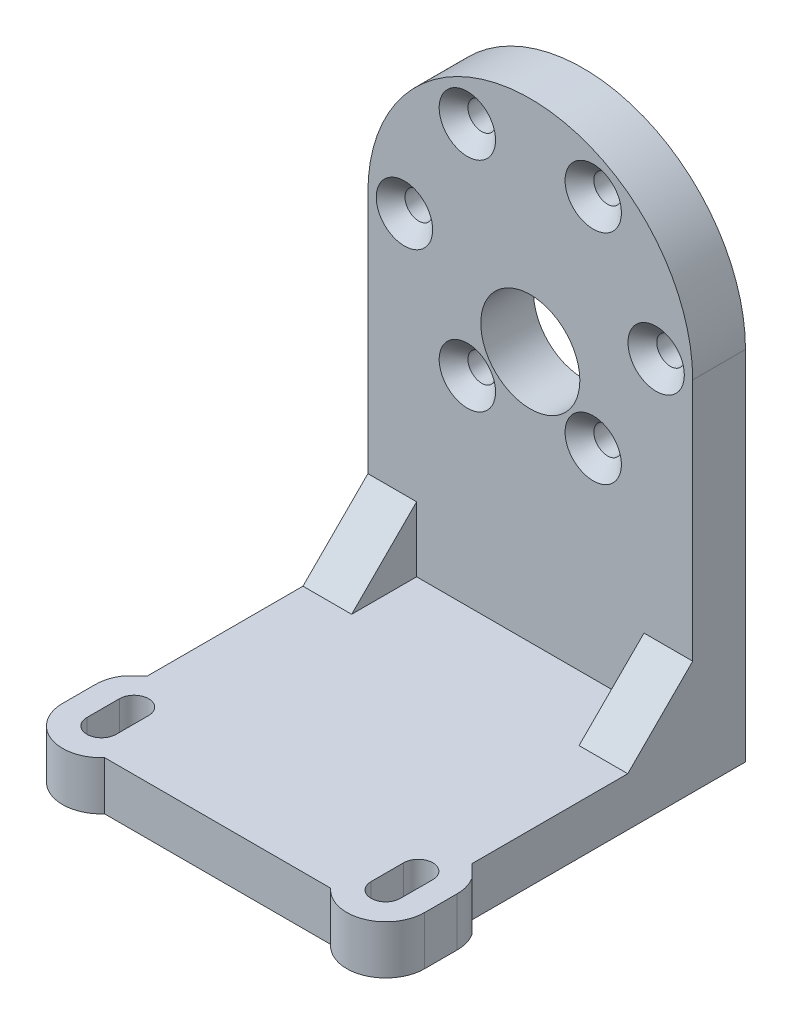
from build123d import *

# Parameters (mm, degrees)
SKETCH1_R                                            = 20
BOSS_EXTRUDE1_DEPTH                                  = 6.5
CSK_FOR_M3_HEX_SOCKET_COUNTERSUNK_HEAD_S_D           = 3.4
CSK_FOR_M3_HEX_SOCKET_COUNTERSUNK_HEAD_S_CSINK_D     = 6.94
CSK_FOR_M3_HEX_SOCKET_COUNTERSUNK_HEAD_S_CSINK_ANGLE = 90
F_12_2_12_2_DIAMETER_HOLE1_D                         = 12.2
BOSS_EXTRUDE2_START                                  = -6.5
BOSS_EXTRUDE2_DEPTH                                  = 6.5
SKETCH7_W                                            = 40
SKETCH7_H                                            = 45
BOSS_EXTRUDE3_DEPTH                                  = 6
M3_CLEARANCE_HOLE2_D                                 = 3.6
CUT_EXTRUDE1_DEPTH                                   = 77.085478247
CUT_EXTRUDE1_DEPTH_BACK                              = 77.085478247
BOSS_EXTRUDE4_DEPTH                                  = 6
CHAMFER1_START                                       = -45
CHAMFER1_DEPTH                                       = 8
CHAMFER1_START_2                                     = -44
CHAMFER1_2_DEPTH                                     = 6
BOSS_EXTRUDE5_DEPTH                                  = 6
BOSS_EXTRUDE6_START                                  = -40
BOSS_EXTRUDE6_DEPTH                                  = 6


with BuildPart() as part:
    # Sketch1 → Boss-Extrude1 (new body)
    with BuildSketch(Plane.XY):
        with Locations(Location((0, 0, 0), (0, 0, 180))):
            Circle(SKETCH1_R)
    extrude(amount=BOSS_EXTRUDE1_DEPTH)

    # CSK for M3 Hex Socket Countersunk Head Screw1 (through all)
    with Locations(Plane.XY.offset(6.5)):
        with Locations((-7.75, -13.423393759), (-15.5, 0), (-7.75, 13.423393759), (7.75, 13.423393759), (15.5, 0), (7.75, -13.423393759)):
            CounterSinkHole(CSK_FOR_M3_HEX_SOCKET_COUNTERSUNK_HEAD_S_D / 2, CSK_FOR_M3_HEX_SOCKET_COUNTERSUNK_HEAD_S_CSINK_D / 2, counter_sink_angle=CSK_FOR_M3_HEX_SOCKET_COUNTERSUNK_HEAD_S_CSINK_ANGLE)

    # Ø12.2 (12.2) Diameter Hole1 (through all)
    with Locations(Plane.XY.offset(6.5)):
        with Locations((0, -7)):
            Hole(F_12_2_12_2_DIAMETER_HOLE1_D / 2)

    # Sketch6 → Boss-Extrude2 (add)
    with BuildSketch(Plane.XY.offset(6.5).offset(BOSS_EXTRUDE2_START)):
        with BuildLine():
            Line((-20, 0), (-20, -38))
            Line((-20, -38), (20, -38))
            Line((20, -38), (20, 0))
            ThreePointArc((20, 0), (0, -20), (-20, 0))
        make_face()
    extrude(amount=BOSS_EXTRUDE2_DEPTH)

    # Sketch7 → Boss-Extrude3 (add)
    with BuildSketch(Plane.XZ.offset(38)):
        with Locations((0, 22.5)):
            Rectangle(SKETCH7_W, SKETCH7_H)
    extrude(amount=BOSS_EXTRUDE3_DEPTH)

    # M3 Clearance Hole2 (through all)
    with Locations(Plane(origin=(0, -44, 0), x_dir=(-1, 0, 0), z_dir=(0, -1, 0))):
        with Locations((-17.5, -39.802814471), (17.5, -39.802814471)):
            Hole(M3_CLEARANCE_HOLE2_D / 2)

    # Sketch11 → Cut-Extrude1 (cut, two sides: drawn at the far end of the back side and taken through both)
    with BuildSketch(Plane(origin=(0, -38, 0), x_dir=(1, 0, 0), z_dir=(0, 1, 0)).offset(-CUT_EXTRUDE1_DEPTH_BACK)):
        with BuildLine():
            Line((-15.7, -37.802814471), (-15.7, -41.802814471))
            ThreePointArc((-15.7, -41.802814471), (-17.5, -43.602814471), (-19.3, -41.802814471))
            Line((-19.3, -41.802814471), (-19.3, -37.802814471))
            ThreePointArc((-19.3, -37.802814471), (-17.5, -36.002814471), (-15.7, -37.802814471))
        make_face()
        with BuildLine():
            Line((15.7, -37.802814471), (15.7, -41.802814471))
            ThreePointArc((15.7, -41.802814471), (17.5, -43.602814471), (19.3, -41.802814471))
            Line((19.3, -41.802814471), (19.3, -37.802814471))
            ThreePointArc((19.3, -37.802814471), (17.5, -36.002814471), (15.7, -37.802814471))
        make_face()
    extrude(amount=CUT_EXTRUDE1_DEPTH + CUT_EXTRUDE1_DEPTH_BACK, mode=Mode.SUBTRACT)

    # Sketch10 → Boss-Extrude4 (add)
    # profile 1 of 2: a face of its own
    with BuildSketch(Plane.XZ.offset(44)):
        with BuildLine():
            Line((-22.3, 37.802814471), (-22.3, 41.802814471))
            ThreePointArc((-22.3, 41.802814471), (-17.5, 46.602814471), (-12.7, 41.802814471))
            Line((-12.7, 41.802814471), (-12.7, 37.802814471))
            ThreePointArc((-12.7, 37.802814471), (-17.5, 33.002814471), (-22.3, 37.802814471))
        make_face()
        with BuildLine():
            Line((-19.3, 37.802814471), (-19.3, 41.802814471))
            ThreePointArc((-19.3, 41.802814471), (-17.5, 43.602814471), (-15.7, 41.802814471))
            Line((-15.7, 41.802814471), (-15.7, 37.802814471))
            ThreePointArc((-15.7, 37.802814471), (-17.5, 36.002814471), (-19.3, 37.802814471))
        make_face(mode=Mode.SUBTRACT)
    # profile 2 of 2: a face of its own
    with BuildSketch(Plane.XZ.offset(44)):
        with BuildLine():
            Line((22.3, 41.802814471), (22.3, 37.802814471))
            ThreePointArc((22.3, 37.802814471), (17.5, 33.002814471), (12.7, 37.802814471))
            Line((12.7, 37.802814471), (12.7, 41.802814471))
            ThreePointArc((12.7, 41.802814471), (17.5, 46.602814471), (22.3, 41.802814471))
        make_face()
        with BuildLine():
            Line((19.3, 41.802814471), (19.3, 37.802814471))
            ThreePointArc((19.3, 37.802814471), (17.5, 36.002814471), (15.7, 37.802814471))
            Line((15.7, 37.802814471), (15.7, 41.802814471))
            ThreePointArc((15.7, 41.802814471), (17.5, 43.602814471), (19.3, 41.802814471))
        make_face(mode=Mode.SUBTRACT)
    extrude(amount=-BOSS_EXTRUDE4_DEPTH)

    # Chamfer1: read off the stored shape, not the designer's step
    # Chamfer1 outline → Chamfer1 (cut)
    with BuildSketch(Plane(origin=(0, 0, 0), x_dir=(1, 0, 0), z_dir=(0, 1, 0)).offset(CHAMFER1_START)):
        with BuildLine():
            Line((20.05286265, -33.7379784), (21.57746495, -35.270171666))
            ThreePointArc((21.57746495, -35.270171666), (20.902530686, -34.417140989), (20.05286265, -33.7379784))
        make_face()
        with BuildLine():
            ThreePointArc((-20.05286265, -33.7379784), (-20.902530686, -34.417140989), (-21.57746495, -35.270171666))
            Line((-21.57746495, -35.270171666), (-20.05286265, -33.7379784))
        make_face()
    extrude(amount=CHAMFER1_DEPTH, mode=Mode.SUBTRACT)

    # Chamfer1 2 outline → Chamfer1 2 (add)
    with BuildSketch(Plane(origin=(0, 0, 0), x_dir=(1, 0, 0), z_dir=(0, 1, 0)).offset(CHAMFER1_START_2)):
        with BuildLine():
            ThreePointArc((20, -33.705254222), (20.026484308, -33.721530722), (20.05286265, -33.7379784))
            Line((20.05286265, -33.7379784), (20, -33.684852548))
            Line((20, -33.684852548), (20, -33.705254222))
        make_face()
        with BuildLine():
            Line((-20, -33.684852548), (-20.05286265, -33.7379784))
            ThreePointArc((-20.05286265, -33.7379784), (-20.026484308, -33.721530722), (-20, -33.705254222))
            Line((-20, -33.705254222), (-20, -33.684852548))
        make_face()
    extrude(amount=CHAMFER1_2_DEPTH)

    # Sketch12 → Boss-Extrude5 (add)
    with BuildSketch(Plane(origin=(20, 0, 0), x_dir=(0, 0, -1), z_dir=(1, 0, 0))):
        Polygon((-6.5, -30), (-14.5, -38), (-6.5, -38), align=None)
    extrude(amount=-BOSS_EXTRUDE5_DEPTH)

    # Sketch12<2> → Boss-Extrude6 (add)
    with BuildSketch(Plane(origin=(20, 0, 0), x_dir=(0, 0, -1), z_dir=(1, 0, 0)).offset(BOSS_EXTRUDE6_START)):
        Polygon((-6.5, -30), (-14.5, -38), (-6.5, -38), align=None)
    extrude(amount=BOSS_EXTRUDE6_DEPTH)


solid = part.part
